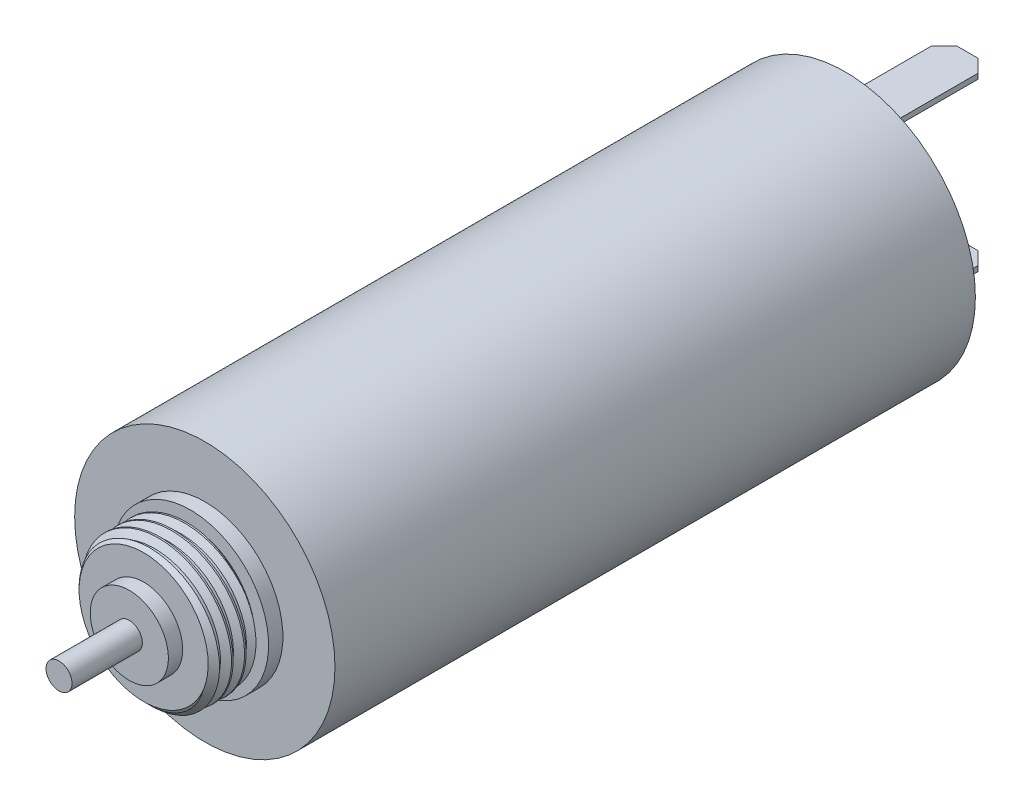
from build123d import *

# Parameters (mm, degrees)
CUT_SWEEP1_PITCH    = 0.5
CUT_SWEEP1_TO       = 1.8
SKETCH8_W           = 1.8
SKETCH8_H           = 0.2
BOSS_EXTRUDE1_DEPTH = 4.7
CHAMFER1_SIZE       = 0.5
SCALE1_SCALE        = 2


with BuildPart() as part:
    # Sketch3 → Revolve1 (revolve)
    with BuildSketch(Plane(origin=(0, 0, 0), x_dir=(0, 0, -1), z_dir=(1, 0, 0)), mode=Mode.PRIVATE) as revolve1_sk:
        Polygon((31.1, 0), (31.1, 1.95), (30.2, 1.95), (30.2, 5), (5.6, 5), (5.6, 3), (5.05, 3), (5.05, 2.75), (3.25, 2.75), (3.25, 1.5), (2.7, 1.5), (2.7, 0.5), (0, 0.5), (0, 0), align=None)
    revolve(revolve1_sk.sketch.rotate(Axis((0, 0, -31.1), (0, 0, 1)), 90), axis=Axis((0, 0, -31.1), (0, 0, 1)))

    # Cut-Sweep1: arcs per turn and ends read off the stored shape
    # Cut-Sweep1: the profile of Sketch6 screwed along a right-hand helix through 5.666667 turns, 6 arcs to a turn; built about Z, then put on its axis
    cut_sweep1_z = Axis((0, 0, 0), (0, 0, 1))
    cut_sweep1_corners = [(2.479367061, 0, -0.65625), (2.479367061, 0, -0.78125), (2.777063294, 0, -0.953125), (2.777063294, 0, -0.484375)]
    with BuildLine(mode=Mode.PRIVATE) as cut_sweep1_profile:
        Line(cut_sweep1_corners[0], cut_sweep1_corners[1])
        Line(cut_sweep1_corners[1], cut_sweep1_corners[2])
        Line(cut_sweep1_corners[2], cut_sweep1_corners[3])
        Line(cut_sweep1_corners[3], cut_sweep1_corners[0])
    cut_sweep1_cap = Face(cut_sweep1_profile.wire())
    cut_sweep1_turn_angles = [0, 30, 60, 90, 120, 150, 180, 210, 240, 270, 300, 330, 360]
    cut_sweep1_turn_weights = [1, 0.8660254037844387, 1, 0.8660254037844387, 1, 0.8660254037844387, 1, 0.8660254037844387, 1, 0.8660254037844387, 1, 0.8660254037844387, 1]
    cut_sweep1_turn_rails = [Edge.make_bspline([Vector(p[0], p[1], 0).rotate(cut_sweep1_z, cut_sweep1_turn_angles[k]) / cut_sweep1_turn_weights[k] + Vector(0, 0, p[2] + CUT_SWEEP1_PITCH * cut_sweep1_turn_angles[k] / 360) for k in range(13)], [0, 0, 0, 1, 1, 2, 2, 3, 3, 4, 4, 5, 5, 6, 6, 6], 2, cut_sweep1_turn_weights) for p in cut_sweep1_corners]
    cut_sweep1_turn_sides = [Face.make_surface_from_curves(cut_sweep1_turn_rails[p[0]], cut_sweep1_turn_rails[p[1]]) for p in [(0, 1), (1, 2), (2, 3), (3, 0)]]
    cut_sweep1_last_angles = [1800, 1830, 1860, 1890, 1920, 1950, 1980, 2010, 2040]
    cut_sweep1_last_weights = [1, 0.8660254037844387, 1, 0.8660254037844387, 1, 0.8660254037844387, 1, 0.8660254037844387, 1]
    cut_sweep1_last_rails = [Edge.make_bspline([Vector(p[0], p[1], 0).rotate(cut_sweep1_z, cut_sweep1_last_angles[k]) / cut_sweep1_last_weights[k] + Vector(0, 0, p[2] + CUT_SWEEP1_PITCH * cut_sweep1_last_angles[k] / 360) for k in range(9)], [0, 0, 0, 1, 1, 2, 2, 3, 3, 4, 4, 4], 2, cut_sweep1_last_weights) for p in cut_sweep1_corners]
    cut_sweep1_last_sides = [Face.make_surface_from_curves(cut_sweep1_last_rails[p[0]], cut_sweep1_last_rails[p[1]]) for p in [(0, 1), (1, 2), (2, 3), (3, 0)]]
    cut_sweep1 = Plane(origin=(0, 0, -3.25), x_dir=(0, 1, 0), z_dir=(0, 0, -1)) * split(Solid(Shell([*[p.moved(Location((0, 0, CUT_SWEEP1_PITCH * i))) for i in range(5) for p in cut_sweep1_turn_sides], *cut_sweep1_last_sides, cut_sweep1_cap, cut_sweep1_cap.rotate(cut_sweep1_z, 2040).moved(Location((0, 0, CUT_SWEEP1_PITCH * 2040 / 360)))])), bisect_by=Plane.XY.offset(CUT_SWEEP1_TO), keep=Keep.BOTTOM, mode=Mode.PRIVATE)
    add(cut_sweep1, mode=Mode.SUBTRACT)

    # Sketch7 → Cut-Revolve1 (revolve, cut)
    with BuildSketch(Plane(origin=(0, 0, 0), x_dir=(0, 0, -1), z_dir=(1, 0, 0))):
        Polygon((3.25, 2.75), (3.25, 2.479367061), (3.520632939, 2.75), align=None)
        Polygon((5.05, 2.75), (4.83125, 2.75), (4.9875, 2.479367061), (5.05, 2.479367061), align=None)
    revolve(axis=Axis((0, 0, 0), (0, 0, -1)), mode=Mode.SUBTRACT)

    # Sketch8 → Boss-Extrude1 (add)
    with BuildSketch(Plane(origin=(0, 0, -30.2), x_dir=(-1, 0, 0), z_dir=(0, 0, -1))):
        with Locations((0, 3.2)):
            Rectangle(SKETCH8_W, SKETCH8_H)
        with Locations((0, -3.2)):
            Rectangle(SKETCH8_W, SKETCH8_H)
    extrude(amount=BOSS_EXTRUDE1_DEPTH)

    # Chamfer1
    chamfer1_edges = [part.edges().sort_by_distance(p)[0] for p in [
        (0.9, 3.2, -34.9),
        (-0.9, 3.2, -34.9),
        (0.9, -3.2, -34.9),
        (-0.9, -3.2, -34.9),
    ]]
    chamfer(chamfer1_edges, length=CHAMFER1_SIZE)


with BuildPart() as part_1:
    # Scale1: scaled about (0, 0, 0)
    add(part.part.scale(SCALE1_SCALE))


solid = part_1.part
